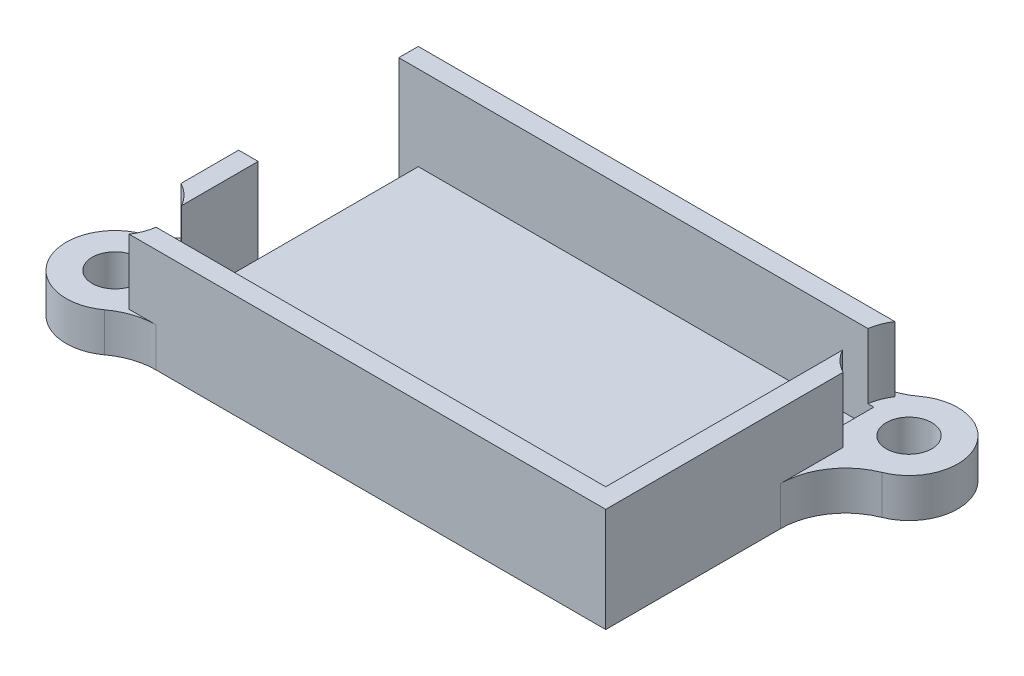
from build123d import *

# Parameters (mm, degrees)
SKETCH1_W           = 35
SKETCH1_H           = 20.6
BOSS_EXTRUDE1_DEPTH = 1.5
SKETCH1_3_R         = 1.75
BOSS_EXTRUDE2_DEPTH = 8
CUT_EXTRUDE1_START  = 3
SKETCH1_5_R         = 3.75
CUT_EXTRUDE1_DEPTH  = 27.094673052
FILLET1_R           = 5


with BuildPart() as part:
    # Sketch1 → Boss-Extrude1 (new body)
    with BuildSketch(Plane(origin=(0, 0, 0), x_dir=(1, 0, 0), z_dir=(0, 1, 0))):
        Rectangle(SKETCH1_W, SKETCH1_H)
        with BuildLine():
            Line((-17.5, -10.3), (-17.040552602, -10.3))
            ThreePointArc((-17.040552602, -10.3), (-17.010151892, -10.025746493), (-17, -9.75))
            ThreePointArc((-17, -9.75), (-17.127155813, -8.781754163), (-17.5, -7.879171307))
            Line((-17.5, -7.879171307), (-17.5, -10.3))
        make_face()
        with BuildLine():
            ThreePointArc((17.040552602, 10.3), (17.065766034, 9.050771792), (17.5, 7.879171307))
            Line((17.5, 7.879171307), (17.5, 10.3))
            Line((17.5, 10.3), (17.040552602, 10.3))
        make_face()
    extrude(amount=BOSS_EXTRUDE1_DEPTH)

    # Sketch1<3> → Boss-Extrude2 (add)
    with BuildSketch(Plane(origin=(0, 0, 0), x_dir=(1, 0, 0), z_dir=(0, 1, 0))):
        with BuildLine():
            Line((-17.5, -10.3), (-17.5, -2))
            Line((-17.5, -2), (-19, -2))
            Line((-19, -2), (-19, -6.43337521))
            ThreePointArc((-19, -6.43337521), (-24.380199188, -10.690294559), (-17.609936306, -11.8))
            Line((-17.609936306, -11.8), (19, -11.8))
            Line((19, -11.8), (19, 6.43337521))
            ThreePointArc((19, 6.43337521), (24.380199188, 10.690294559), (17.609936306, 11.8))
            Line((17.609936306, 11.8), (-19, 11.8))
            Line((-19, 11.8), (-19, 10.3))
            Line((-19, 10.3), (17.5, 10.3))
            Line((17.5, 10.3), (17.5, -10.3))
            Line((17.5, -10.3), (-17.5, -10.3))
        make_face()
        with Locations(Location((-20.75, -9.75, 0), (0, 0, 270))):
            Circle(SKETCH1_3_R, mode=Mode.SUBTRACT)
        with Locations(Location((20.75, 9.75, 0), (0, 0, 270))):
            Circle(SKETCH1_3_R, mode=Mode.SUBTRACT)
    extrude(amount=BOSS_EXTRUDE2_DEPTH)

    # Sketch1<5> → Cut-Extrude1 (cut, through all)
    with BuildSketch(Plane(origin=(0, 0, 0), x_dir=(1, 0, 0), z_dir=(0, 1, 0)).offset(CUT_EXTRUDE1_START)):
        with Locations((20.75, 9.75)):
            Circle(SKETCH1_5_R)
        with Locations((-20.75, -9.75)):
            Circle(SKETCH1_5_R)
    extrude(amount=CUT_EXTRUDE1_DEPTH, mode=Mode.SUBTRACT)

    # Fillet1
    # the kernel refuses this fillet: 5 mm, written as the material it adds along each edge
    with BuildSketch(Plane(origin=(-19, 0, 6.43337521), x_dir=(-0.9985759338365271, 0, -0.05334889279551997), z_dir=(0, 1, 0))) as fillet1_piece_1:
        with BuildLine():
            CenterArc((5.235232079, -4.540349679), FILLET1_R, 114.760021094, 63.94168422)
            Line((0.236515659, -4.42706179), (0, 0))
            ThreePointArc((0, 0), (1.570569624, -0.34473774), (3.141139248, 0))
        make_face()
    extrude(amount=3)
    with BuildSketch(Plane(origin=(-17.609936306, 0, 11.8), x_dir=(-0.6872011618867198, 0, 0.7264671796451251), z_dir=(0, 1, 0))) as fillet1_piece_2:
        with BuildLine():
            CenterArc((2.228659001, 4.919887463), FILLET1_R, 223.40896289, 36.320705761)
            Line((-1.403676897, 1.483881654), (0, 0))
            ThreePointArc((0, 0), (0.6685977, 0.060084403), (1.337195401, 0))
        make_face()
    extrude(amount=3)
    with BuildSketch(Plane(origin=(17.609936306, 0, -11.8), x_dir=(-1, 0, 0), z_dir=(0, 1, 0))) as fillet1_piece_3:
        with BuildLine():
            CenterArc((2.042599714, -5), FILLET1_R, 90, 36.320705761)
            ThreePointArc((-0.918922233, -0.971428571), (-0.41581177, -0.527004357), (0, 0))
            Line((0, 0), (2.042599714, 0))
        make_face()
    extrude(amount=3)
    with BuildSketch(Plane(origin=(19, 0, -6.43337521), x_dir=(0.9986229541246332, 0, 0.052461371459300826), z_dir=(0, 1, 0))) as fillet1_piece_4:
        with BuildLine():
            CenterArc((5.245318282, -4.538486728), FILLET1_R, 114.810943637, 68.196252011)
            Line((0.252203511, -4.800793585), (0, 0))
            ThreePointArc((0, 0), (1.573595485, -0.346134954), (3.147190969, 0))
        make_face()
    extrude(amount=3)


solid = part.part
